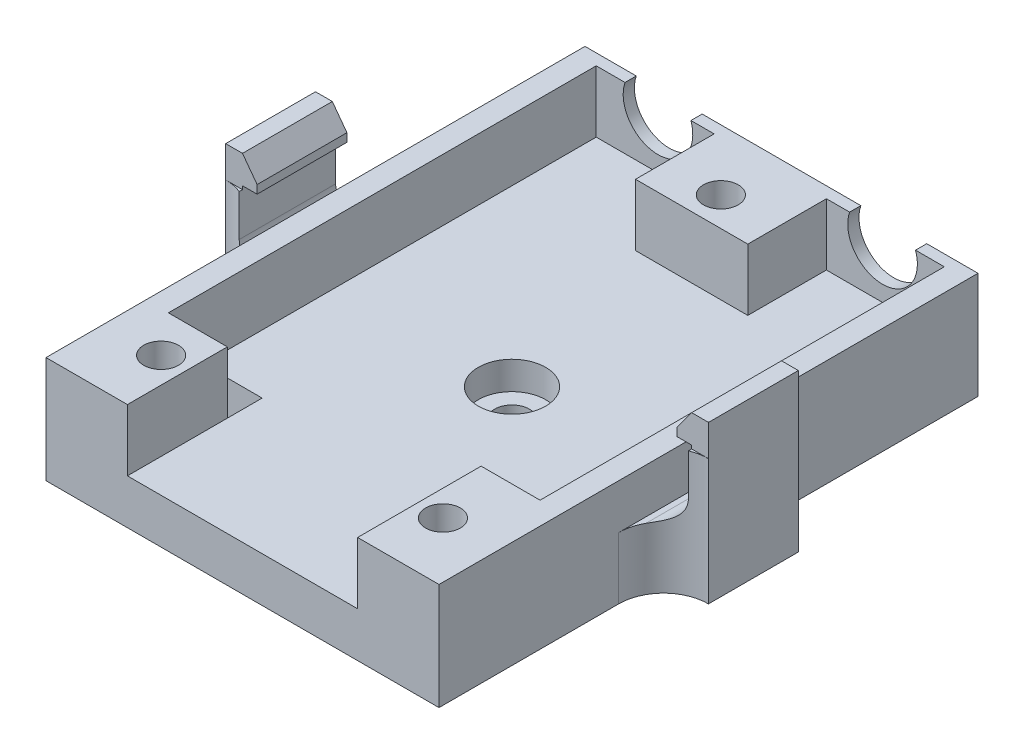
from build123d import *

# Parameters (mm, degrees)
SKETCH1_W           = 35
SKETCH1_H           = 48
BOSS_EXTRUDE1_DEPTH = 4
SKETCH2_W           = 35
SKETCH2_H           = 48
SKETCH2_W_2         = 31
SKETCH2_H_2         = 44
BOSS_EXTRUDE2_DEPTH = 5.5
SKETCH3_W           = 10
SKETCH3_H           = 7
SKETCH3_W_2         = 5.25
SKETCH3_H_2         = 8
BOSS_EXTRUDE3_DEPTH = 5.5
SKETCH4_W           = 20.5
SKETCH4_H           = 5.5
CUT_EXTRUDE1_DEPTH  = 11
CUT_EXTRUDE2_DEPTH  = 2
CUT_EXTRUDE3_REACH  = 33.185
SKETCH7_W           = 5.25
SKETCH7_H           = 3.1
CUT_EXTRUDE4_START  = 9.5
SKETCH8_R           = 1.55
CUT_EXTRUDE4_DEPTH  = 5.5
SKETCH5_W           = 5
SKETCH5_H           = 5
CUT_EXTRUDE5_DEPTH  = 2
SKETCH10_R          = 1.55
CUT_EXTRUDE6_DEPTH  = 4
SKETCH11_R          = 3
CUT_EXTRUDE7_DEPTH  = 2.5
BOSS_EXTRUDE5_DEPTH = 4
FILLET1_R           = 4
FILLET2_R           = 2
FILLET3_R           = 4
FILLET4_R           = 2
SKETCH14_W          = 45
SKETCH14_H          = 12
CUT_EXTRUDE11_DEPTH = 2.8


with BuildPart() as part:
    # Sketch1 → Boss-Extrude1 (new body)
    with BuildSketch(Plane(origin=(0, 0, 0), x_dir=(1, 0, 0), z_dir=(0, 1, 0))):
        Rectangle(SKETCH1_W, SKETCH1_H)
    extrude(amount=BOSS_EXTRUDE1_DEPTH)

    # Sketch2 → Boss-Extrude2 (add)
    with BuildSketch(Plane(origin=(0, 4, 0), x_dir=(1, 0, 0), z_dir=(0, 1, 0))):
        Rectangle(SKETCH2_W, SKETCH2_H)
        with Locations((0, 1)):
            Rectangle(SKETCH2_W_2, SKETCH2_H_2, mode=Mode.SUBTRACT)
    extrude(amount=BOSS_EXTRUDE2_DEPTH)

    # Sketch3 → Boss-Extrude3 (add)
    with BuildSketch(Plane(origin=(0, 4, 0), x_dir=(1, 0, 0), z_dir=(0, 1, 0))):
        with Locations((0, 19.5)):
            Rectangle(SKETCH3_W, SKETCH3_H)
        with Locations((-12.875, -17)):
            Rectangle(SKETCH3_W_2, SKETCH3_H_2)
        with Locations((12.875, -17)):
            Rectangle(SKETCH3_W_2, SKETCH3_H_2)
    extrude(amount=BOSS_EXTRUDE3_DEPTH)

    # Sketch4 → Cut-Extrude1 (cut)
    with BuildSketch(Plane.XY.offset(24)):
        with Locations((0, 6.75)):
            Rectangle(SKETCH4_W, SKETCH4_H)
    extrude(amount=-CUT_EXTRUDE1_DEPTH, mode=Mode.SUBTRACT)

    # Sketch6 → Cut-Extrude2 (cut)
    with BuildSketch(Plane(origin=(0, 0, -24), x_dir=(-1, 0, 0), z_dir=(0, 0, -1))):
        with BuildLine():
            ThreePointArc((-12.93428015, 9.5), (-10, 5.4), (-7.06571985, 9.5))
            Line((-7.06571985, 9.5), (-12.93428015, 9.5))
        make_face()
        with BuildLine():
            Line((12.93428015, 9.5), (7.06571985, 9.5))
            ThreePointArc((7.06571985, 9.5), (10, 5.4), (12.93428015, 9.5))
        make_face()
    extrude(amount=-CUT_EXTRUDE2_DEPTH, mode=Mode.SUBTRACT)

    # Cut-Extrude3: up to this face of the body (flat: up to its plane)
    cut_extrude3_end = Plane(part.part.faces().sort_by_distance((0, 0, 0))[0])
    # Sketch7 → Cut-Extrude3 (cut, up to the picked face)
    with BuildSketch(Plane(origin=(0, 9.5, 0), x_dir=(1, 0, 0), z_dir=(0, 1, 0)), mode=Mode.PRIVATE) as cut_extrude3_sk1:
        with Locations((-12.875, -13.55)):
            Rectangle(SKETCH7_W, SKETCH7_H)
    cut_extrude3_tool1 = split(extrude(cut_extrude3_sk1.sketch, amount=-CUT_EXTRUDE3_REACH, mode=Mode.PRIVATE), bisect_by=cut_extrude3_end, keep=Keep.BOTH, mode=Mode.PRIVATE)
    add(cut_extrude3_tool1.solids().sort_by(Axis((-12.875, 9.5, 13.55), (0, -1, 0)))[0], mode=Mode.SUBTRACT)

    # Sketch8 → Cut-Extrude4 (cut)
    with BuildSketch(Plane(origin=(0, 0, 0), x_dir=(1, 0, 0), z_dir=(0, 1, 0)).offset(CUT_EXTRUDE4_START)):
        with Locations(Location((-12.55, -18.7, 0), (0, 0, 270))):
            Circle(SKETCH8_R)
        with Locations(Location((12.55, -18.7, 0), (0, 0, 270))):
            Circle(SKETCH8_R)
        with Locations(Location((0, 18.6, 0), (0, 0, 270))):
            Circle(SKETCH8_R)
    extrude(amount=-CUT_EXTRUDE4_DEPTH, mode=Mode.SUBTRACT)

    # Sketch5 → Cut-Extrude5 (cut)
    with BuildSketch(Plane.XZ):
        with Locations((-0.05, 6.1)):
            Rectangle(SKETCH5_W, SKETCH5_H)
        with Locations((-0.05, -6.1)):
            Rectangle(SKETCH5_W, SKETCH5_H)
    extrude(amount=-CUT_EXTRUDE5_DEPTH, mode=Mode.SUBTRACT)

    # Sketch10 → Cut-Extrude6 (cut)
    with BuildSketch(Plane.XZ):
        with Locations(Location((0, 0, 0), (0, 0, 270))):
            Circle(SKETCH10_R)
    extrude(amount=-CUT_EXTRUDE6_DEPTH, mode=Mode.SUBTRACT)

    # Sketch11 → Cut-Extrude7 (cut)
    with BuildSketch(Plane(origin=(0, 4, 0), x_dir=(1, 0, 0), z_dir=(0, 1, 0))):
        with Locations(Location((0, 0, 0), (0, 0, 270))):
            Circle(SKETCH11_R)
    extrude(amount=-CUT_EXTRUDE7_DEPTH, mode=Mode.SUBTRACT)

    # Sketch13 → Boss-Extrude5 (add, symmetric)
    with BuildSketch(Plane.XY):
        Polygon((17.5, 0), (21.5, 0), (21.5, 14), (20, 14), (18.7, 12.243021796), (18.7, 11.5), (20, 11.5), (20, 5.5), (17.5, 5.5), align=None)
    boss_extrude5 = extrude(amount=BOSS_EXTRUDE5_DEPTH, both=True)

    # Fillet1
    # the kernel refuses this fillet: 4 mm, written as the material it adds along each edge
    with BuildSketch(Plane(origin=(17.5, 15.5, -4), x_dir=(0, 0, -1), z_dir=(0, -1, 0))) as fillet1_piece_1_section:
        with BuildLine():
            CenterArc((FILLET1_R, FILLET1_R), FILLET1_R, 180, 90)
            Line((0, FILLET1_R), (0, 0))
            Line((0, 0), (FILLET1_R, 0))
        make_face()
    fillet1_piece_1 = extrude(amount=15.5, mode=Mode.PRIVATE)
    fillet1_piece_1 = split(fillet1_piece_1, bisect_by=Plane(origin=(20.372208791, 14, -4.086993852), z_dir=(0, -1, 0)), keep=Keep.TOP, mode=Mode.PRIVATE)
    fillet1_piece_1 = split(fillet1_piece_1, bisect_by=Plane(origin=(20, 12.75, -4.086993852), z_dir=(1, 0, 0)), keep=Keep.TOP, mode=Mode.PRIVATE)
    add(fillet1_piece_1)
    with BuildSketch(Plane(origin=(17.5, 15.5, -4), x_dir=(0, 0, -1), z_dir=(0, -1, 0))) as fillet1_piece_2_section:
        with BuildLine():
            CenterArc((FILLET1_R, FILLET1_R), FILLET1_R, 180, 90)
            Line((0, FILLET1_R), (0, 0))
            Line((0, 0), (FILLET1_R, 0))
        make_face()
    fillet1_piece_2 = extrude(amount=25.5, mode=Mode.PRIVATE)
    fillet1_piece_2 = split(fillet1_piece_2, bisect_by=Plane(origin=(18.94916854, 12.579778484, -4.333743355), z_dir=(0.8038777485339549, -0.5947945573153639, 0)), keep=Keep.TOP, mode=Mode.PRIVATE)
    fillet1_piece_2 = split(fillet1_piece_2, bisect_by=Plane(origin=(18.7, 12.297602293, -4.333743355), z_dir=(1, 0, 0)), keep=Keep.TOP, mode=Mode.PRIVATE)
    fillet1_piece_2 = split(fillet1_piece_2, bisect_by=Plane(origin=(19.330535784, 11.5, -4.333743355), z_dir=(0, 1, 0)), keep=Keep.TOP, mode=Mode.PRIVATE)
    fillet1_piece_2 = split(fillet1_piece_2, bisect_by=Plane(origin=(20, 12.297602293, -4.333743355), z_dir=(-1, 0, 0)), keep=Keep.TOP, mode=Mode.PRIVATE)
    add(fillet1_piece_2)
    with BuildSketch(Plane(origin=(17.5, 5.5, -4), x_dir=(0, 0, -1), z_dir=(0, -1, 0))) as fillet1_piece_3:
        with BuildLine():
            CenterArc((FILLET1_R, FILLET1_R), FILLET1_R, 180, 90)
            Line((0, FILLET1_R), (0, 0))
            Line((0, 0), (FILLET1_R, 0))
        make_face()
    extrude(amount=5.5)
    with BuildSketch(Plane(origin=(17.5, 15.5, 4), x_dir=(0, 0, 1), z_dir=(0, -1, 0))) as fillet1_piece_4_section:
        with BuildLine():
            CenterArc((FILLET1_R, -FILLET1_R), FILLET1_R, 90, 90)
            Line((0, -FILLET1_R), (0, 0))
            Line((0, 0), (FILLET1_R, 0))
        make_face()
    fillet1_piece_4 = extrude(amount=15.5, mode=Mode.PRIVATE)
    fillet1_piece_4 = split(fillet1_piece_4, bisect_by=Plane(origin=(20.372208791, 14, 4.086993852), z_dir=(0, -1, 0)), keep=Keep.TOP, mode=Mode.PRIVATE)
    fillet1_piece_4 = split(fillet1_piece_4, bisect_by=Plane(origin=(20, 12.75, 4.086993852), z_dir=(1, 0, 0)), keep=Keep.TOP, mode=Mode.PRIVATE)
    add(fillet1_piece_4)
    with BuildSketch(Plane(origin=(17.5, 15.5, 4), x_dir=(0, 0, 1), z_dir=(0, -1, 0))) as fillet1_piece_5_section:
        with BuildLine():
            CenterArc((FILLET1_R, -FILLET1_R), FILLET1_R, 90, 90)
            Line((0, -FILLET1_R), (0, 0))
            Line((0, 0), (FILLET1_R, 0))
        make_face()
    fillet1_piece_5 = extrude(amount=25.5, mode=Mode.PRIVATE)
    fillet1_piece_5 = split(fillet1_piece_5, bisect_by=Plane(origin=(18.94916854, 12.579778484, 4.333743355), z_dir=(0.8038777485339549, -0.5947945573153639, 0)), keep=Keep.TOP, mode=Mode.PRIVATE)
    fillet1_piece_5 = split(fillet1_piece_5, bisect_by=Plane(origin=(18.7, 12.297602293, 4.333743355), z_dir=(1, 0, 0)), keep=Keep.TOP, mode=Mode.PRIVATE)
    fillet1_piece_5 = split(fillet1_piece_5, bisect_by=Plane(origin=(19.330535784, 11.5, 4.333743355), z_dir=(0, 1, 0)), keep=Keep.TOP, mode=Mode.PRIVATE)
    fillet1_piece_5 = split(fillet1_piece_5, bisect_by=Plane(origin=(20, 12.297602293, 4.333743355), z_dir=(-1, 0, 0)), keep=Keep.TOP, mode=Mode.PRIVATE)
    add(fillet1_piece_5)
    with BuildSketch(Plane(origin=(17.5, 5.5, 4), x_dir=(0, 0, 1), z_dir=(0, -1, 0))) as fillet1_piece_6:
        with BuildLine():
            CenterArc((FILLET1_R, -FILLET1_R), FILLET1_R, 90, 90)
            Line((0, -FILLET1_R), (0, 0))
            Line((0, 0), (FILLET1_R, 0))
        make_face()
    extrude(amount=5.5)

    # Fillet2
    fillet2_edges = [part.edges().sort_by_distance(p)[0] for p in [
        (20, 5.5, 0),
    ]]
    fillet(fillet2_edges, radius=FILLET2_R)

    # Mirror4: Boss-Extrude5 across plane
    add(boss_extrude5.mirror(Plane(origin=(0, 0, 0), x_dir=(0, 0, 1), z_dir=(1, 0, 0))))

    # Fillet3
    # the kernel refuses this fillet: 4 mm, written as the material it adds along each edge
    with BuildSketch(Plane(origin=(-17.5, 15.5, 4), x_dir=(0, 0, 1), z_dir=(0, -1, 0))) as fillet3_piece_1_section:
        with BuildLine():
            CenterArc((FILLET3_R, FILLET3_R), FILLET3_R, 180, 90)
            Line((0, FILLET3_R), (0, 0))
            Line((0, 0), (FILLET3_R, 0))
        make_face()
    fillet3_piece_1 = extrude(amount=25.5, mode=Mode.PRIVATE)
    fillet3_piece_1 = split(fillet3_piece_1, bisect_by=Plane(origin=(-19.330535784, 14, 4.333743355), z_dir=(0, -1, 0)), keep=Keep.TOP, mode=Mode.PRIVATE)
    fillet3_piece_1 = split(fillet3_piece_1, bisect_by=Plane(origin=(-18.94916854, 12.579778484, 4.333743355), z_dir=(-0.8038777485339549, -0.5947945573153639, 0)), keep=Keep.TOP, mode=Mode.PRIVATE)
    fillet3_piece_1 = split(fillet3_piece_1, bisect_by=Plane(origin=(-18.7, 12.297602293, 4.333743355), z_dir=(-1, 0, 0)), keep=Keep.TOP, mode=Mode.PRIVATE)
    fillet3_piece_1 = split(fillet3_piece_1, bisect_by=Plane(origin=(-19.330535784, 11.5, 4.333743355), z_dir=(0, 1, 0)), keep=Keep.TOP, mode=Mode.PRIVATE)
    add(fillet3_piece_1)
    with BuildSketch(Plane(origin=(-17.5, 15.5, 4), x_dir=(0, 0, 1), z_dir=(0, -1, 0))) as fillet3_piece_2_section:
        with BuildLine():
            CenterArc((FILLET3_R, FILLET3_R), FILLET3_R, 180, 90)
            Line((0, FILLET3_R), (0, 0))
            Line((0, 0), (FILLET3_R, 0))
        make_face()
    fillet3_piece_2 = extrude(amount=15.5, mode=Mode.PRIVATE)
    fillet3_piece_2 = split(fillet3_piece_2, bisect_by=Plane(origin=(-20.372208791, 11.5, 4.086993852), z_dir=(0, -1, 0)), keep=Keep.TOP, mode=Mode.PRIVATE)
    fillet3_piece_2 = split(fillet3_piece_2, bisect_by=Plane(origin=(-20, 10.5, 4.086993852), z_dir=(-1, 0, 0)), keep=Keep.TOP, mode=Mode.PRIVATE)
    add(fillet3_piece_2)
    with BuildSketch(Plane(origin=(-17.5, 5.5, 4), x_dir=(0, 0, 1), z_dir=(0, -1, 0))) as fillet3_piece_3:
        with BuildLine():
            CenterArc((FILLET3_R, FILLET3_R), FILLET3_R, 180, 90)
            Line((0, FILLET3_R), (0, 0))
            Line((0, 0), (FILLET3_R, 0))
        make_face()
    extrude(amount=5.5)
    with BuildSketch(Plane(origin=(-17.5, 15.5, -4), x_dir=(0, 0, -1), z_dir=(0, -1, 0))) as fillet3_piece_4_section:
        with BuildLine():
            CenterArc((FILLET3_R, -FILLET3_R), FILLET3_R, 90, 90)
            Line((0, -FILLET3_R), (0, 0))
            Line((0, 0), (FILLET3_R, 0))
        make_face()
    fillet3_piece_4 = extrude(amount=25.5, mode=Mode.PRIVATE)
    fillet3_piece_4 = split(fillet3_piece_4, bisect_by=Plane(origin=(-19.330535784, 14, -4.333743355), z_dir=(0, -1, 0)), keep=Keep.TOP, mode=Mode.PRIVATE)
    fillet3_piece_4 = split(fillet3_piece_4, bisect_by=Plane(origin=(-18.94916854, 12.579778484, -4.333743355), z_dir=(-0.8038777485339549, -0.5947945573153639, 0)), keep=Keep.TOP, mode=Mode.PRIVATE)
    fillet3_piece_4 = split(fillet3_piece_4, bisect_by=Plane(origin=(-18.7, 12.297602293, -4.333743355), z_dir=(-1, 0, 0)), keep=Keep.TOP, mode=Mode.PRIVATE)
    fillet3_piece_4 = split(fillet3_piece_4, bisect_by=Plane(origin=(-19.330535784, 11.5, -4.333743355), z_dir=(0, 1, 0)), keep=Keep.TOP, mode=Mode.PRIVATE)
    add(fillet3_piece_4)
    with BuildSketch(Plane(origin=(-17.5, 15.5, -4), x_dir=(0, 0, -1), z_dir=(0, -1, 0))) as fillet3_piece_5_section:
        with BuildLine():
            CenterArc((FILLET3_R, -FILLET3_R), FILLET3_R, 90, 90)
            Line((0, -FILLET3_R), (0, 0))
            Line((0, 0), (FILLET3_R, 0))
        make_face()
    fillet3_piece_5 = extrude(amount=15.5, mode=Mode.PRIVATE)
    fillet3_piece_5 = split(fillet3_piece_5, bisect_by=Plane(origin=(-20.372208791, 11.5, -4.086993852), z_dir=(0, -1, 0)), keep=Keep.TOP, mode=Mode.PRIVATE)
    fillet3_piece_5 = split(fillet3_piece_5, bisect_by=Plane(origin=(-20, 10.5, -4.086993852), z_dir=(-1, 0, 0)), keep=Keep.TOP, mode=Mode.PRIVATE)
    add(fillet3_piece_5)
    with BuildSketch(Plane(origin=(-17.5, 5.5, -4), x_dir=(0, 0, -1), z_dir=(0, -1, 0))) as fillet3_piece_6:
        with BuildLine():
            CenterArc((FILLET3_R, -FILLET3_R), FILLET3_R, 90, 90)
            Line((0, -FILLET3_R), (0, 0))
            Line((0, 0), (FILLET3_R, 0))
        make_face()
    extrude(amount=5.5)

    # Fillet4
    fillet4_edges = [part.edges().sort_by_distance(p)[0] for p in [
        (-20, 5.5, 0),
    ]]
    fillet(fillet4_edges, radius=FILLET4_R)

    # Sketch14 → Cut-Extrude11 (cut)
    # profile 1 of 3: a face of its own
    with BuildSketch(Plane(origin=(0, 14, 0), x_dir=(1, 0, 0), z_dir=(0, 1, 0))):
        Rectangle(SKETCH14_W, SKETCH14_H)
        with BuildLine():
            Line((-21.5, -4), (-21.5, 4))
            Line((-21.5, 4), (20, 4))
            Line((20, 4), (20, 4.291900756))
            ThreePointArc((20, 4.291900756), (20.73593095, 4.07365329), (21.5, 4))
            Line((21.5, 4), (21.5, -4))
            ThreePointArc((21.5, -4), (20.73593095, -4.07365329), (20, -4.291900756))
            Line((20, -4.291900756), (20, -4))
            Line((20, -4), (-21.5, -4))
        make_face(mode=Mode.SUBTRACT)
    # profile 2 of 3: a face of its own
    with BuildSketch(Plane(origin=(0, 14, 0), x_dir=(1, 0, 0), z_dir=(0, 1, 0))):
        with BuildLine():
            Line((20, 4.291900756), (20, 4))
            Line((20, 4), (21.5, 4))
            ThreePointArc((21.5, 4), (20.73593095, 4.07365329), (20, 4.291900756))
        make_face()
    # profile 3 of 3: a face of its own
    with BuildSketch(Plane(origin=(0, 14, 0), x_dir=(1, 0, 0), z_dir=(0, 1, 0))):
        with BuildLine():
            Line((21.5, -4), (20, -4))
            Line((20, -4), (20, -4.291900756))
            ThreePointArc((20, -4.291900756), (20.73593095, -4.07365329), (21.5, -4))
        make_face()
    extrude(amount=-CUT_EXTRUDE11_DEPTH, mode=Mode.SUBTRACT)


solid = part.part
